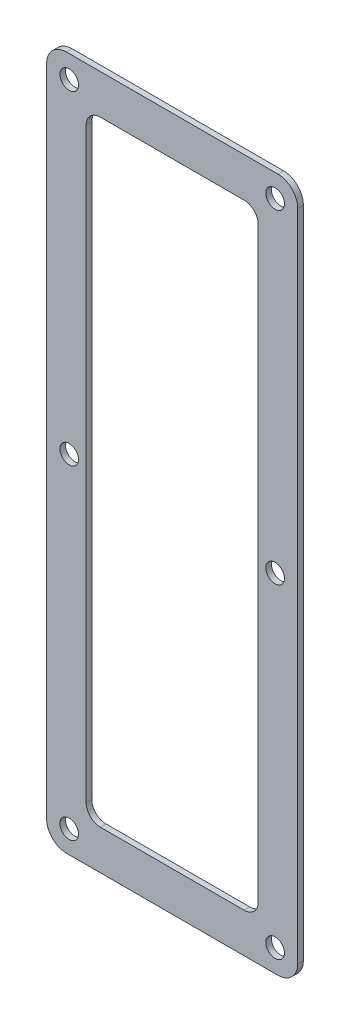
from build123d import *

# Parameters (mm, degrees)
SKETCH_1_W              = 89
SKETCH_1_H              = 246
SKETCH_1_W_2            = 61
SKETCH_1_H_2            = 218
EXTRUDE_1_DEPTH         = 2
FILLET_1_R              = 5
FILLET_2_R              = 7
HOLE_WIZARD_1_OUTLINE_R = 3.3
HOLE_WIZARD_1_DEPTH     = 2


# Read off the part's stored shape, not the designer's step: 孔1
with BuildPart() as part:
    # 草图1 → 凸台-拉伸1 (new body)
    with BuildSketch(Plane.XY):
        Rectangle(SKETCH_1_W, SKETCH_1_H)
        Rectangle(SKETCH_1_W_2, SKETCH_1_H_2, mode=Mode.SUBTRACT)
    extrude(amount=EXTRUDE_1_DEPTH)

    # 圆角1
    fillet_1_edges = [part.edges().sort_by_distance(p)[0] for p in [
        (30.5, -109, 1),
        (30.5, 109, 1),
        (-30.5, 109, 1),
        (-30.5, -109, 1),
    ]]
    fillet(fillet_1_edges, radius=FILLET_1_R)

    # 圆角2
    fillet_2_edges = [part.edges().sort_by_distance(p)[0] for p in [
        (44.5, -123, 1),
        (-44.5, -123, 1),
        (-44.5, 123, 1),
        (44.5, 123, 1),
    ]]
    fillet(fillet_2_edges, radius=FILLET_2_R)

    # 孔1 outline → 孔1 (cut)
    with BuildSketch(Plane.XY):
        with Locations((36.5, 0)):
            Circle(HOLE_WIZARD_1_OUTLINE_R)
        with Locations((-36.5, 0)):
            Circle(HOLE_WIZARD_1_OUTLINE_R)
        with Locations((36.5, -115)):
            Circle(HOLE_WIZARD_1_OUTLINE_R)
        with Locations((-36.5, 115)):
            Circle(HOLE_WIZARD_1_OUTLINE_R)
        with Locations((-36.5, -115)):
            Circle(HOLE_WIZARD_1_OUTLINE_R)
        with Locations((36.5, 115)):
            Circle(HOLE_WIZARD_1_OUTLINE_R)
    extrude(amount=HOLE_WIZARD_1_DEPTH, mode=Mode.SUBTRACT)


solid = part.part
